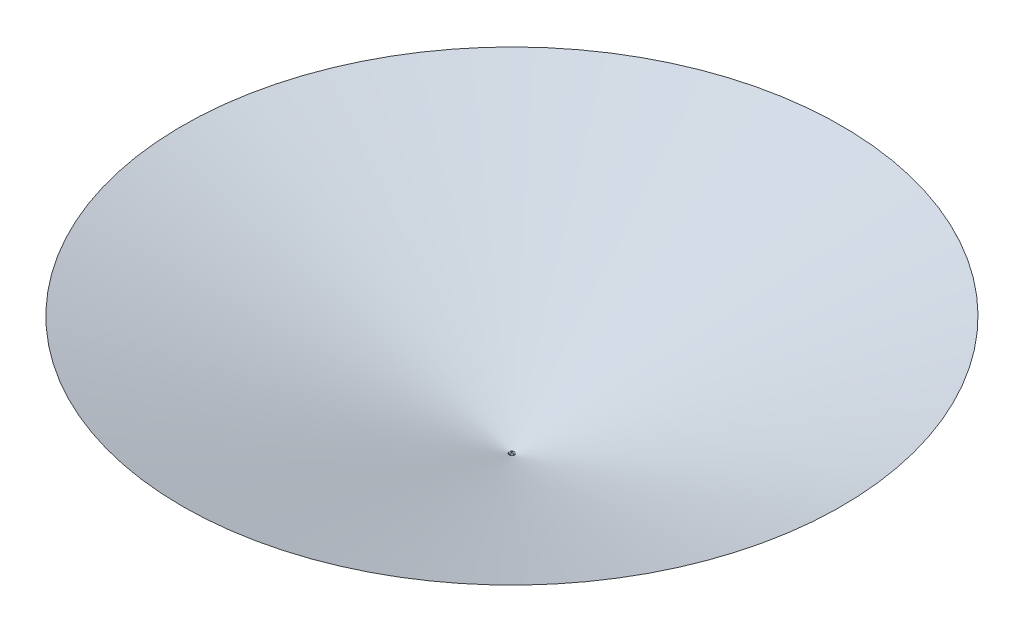
from build123d import *

# Parameters (mm, degrees)
SKETCH1_W           = 38
SKETCH1_H           = 38
BOSS_EXTRUDE1_DEPTH = 1.6
BOSS_EXTRUDE2_DEPTH = 3.5
SKETCH3_R           = 1.25
BOSS_EXTRUDE3_DEPTH = 5
CIRPATTERN1_COUNT   = 22
SKETCH5_W           = 7.5
SKETCH5_H           = 3.75
BOSS_EXTRUDE4_DEPTH = 4.75
SKETCH6_R           = 1.4
SKETCH6_R_2         = 0.35
CUT_EXTRUDE1_DEPTH  = 32.401632123


# Read off the part's stored shape, not the designer's step: FOV
with BuildPart() as part:
    # Sketch1 → Boss-Extrude1 (new body)
    with BuildSketch(Plane(origin=(0, 0, 0), x_dir=(1, 0, 0), z_dir=(0, 1, 0))):
        Rectangle(SKETCH1_W, SKETCH1_H)
    extrude(amount=BOSS_EXTRUDE1_DEPTH)

    # Sketch2 → Boss-Extrude2 (add)
    with BuildSketch(Plane(origin=(0, 1.6, 0), x_dir=(1, 0, 0), z_dir=(0, 1, 0))):
        with BuildLine():
            Line((-6.55, 2), (-9, 2))
            ThreePointArc((-9, 2), (-11, 0), (-9, -2))
            Line((-9, -2), (-6.55, -2))
            Line((-6.55, -2), (-6.55, -6.55))
            Line((-6.55, -6.55), (6.55, -6.55))
            Line((6.55, -6.55), (6.55, -2))
            Line((6.55, -2), (9, -2))
            ThreePointArc((9, -2), (11, 0), (9, 2))
            Line((9, 2), (6.55, 2))
            Line((6.55, 2), (6.55, 6.55))
            Line((6.55, 6.55), (-6.55, 6.55))
            Line((-6.55, 6.55), (-6.55, 2))
        make_face()
    extrude(amount=BOSS_EXTRUDE2_DEPTH)

    # Sketch4 → Revolve1 (revolve)
    with BuildSketch(Plane.XY, mode=Mode.PRIVATE) as revolve1_sk:
        with BuildLine():
            Line((0, 0), (0, 17.65))
            ThreePointArc((0, 17.65), (-2.096194346, 17.328770041), (-4, 16.394562647))
            Line((-4, 16.394562647), (-4, 16.494562647))
            Line((-4, 16.494562647), (-6.5, 17.85))
            Line((-6.5, 17.85), (-7, 17.85))
            Line((-7, 17.85), (-7, 13.55))
            Line((-7, 13.55), (-5.5, 13.55))
            Line((-5.5, 13.55), (-5.5, 0))
            Line((-5.5, 0), (0, 0))
        make_face()
    revolve(revolve1_sk.sketch.rotate(Axis((0, 0, 0), (0, -1, 0)), 270), axis=Axis((0, 0, 0), (0, -1, 0)))

    # Sketch3 → Boss-Extrude3 (add)
    with BuildSketch(Plane(origin=(0, 5.1, 0), x_dir=(1, 0, 0), z_dir=(0, 1, 0))):
        with Locations((5.7, 0)):
            Circle(SKETCH3_R)
    boss_extrude3 = extrude(amount=BOSS_EXTRUDE3_DEPTH)

    # CirPattern1: Boss-Extrude3 ×22 about axis
    cirpattern1_axis = Axis((0, 0, 0), (0, 1, 0))
    for i in range(1, CIRPATTERN1_COUNT):
        add(boss_extrude3.rotate(cirpattern1_axis, i * 360 / CIRPATTERN1_COUNT))

    # Sketch5 → Boss-Extrude4 (add)
    with BuildSketch(Plane.XZ):
        with Locations((-6.75, 13.525)):
            Rectangle(SKETCH5_W, SKETCH5_H)
    extrude(amount=BOSS_EXTRUDE4_DEPTH)

    # Sketch6 → Cut-Extrude1 (cut, through all)
    with BuildSketch(Plane(origin=(0, 1.6, 0), x_dir=(1, 0, 0), z_dir=(0, 1, 0))):
        with Locations(Location((-14, 14, 0), (0, 0, 270))):
            Circle(SKETCH6_R)
        with Locations(Location((-7.25, 16.65, 0), (0, 0, 270))):
            Circle(SKETCH6_R_2)
        with Locations(Location((7.25, 16.65, 0), (0, 0, 270))):
            Circle(SKETCH6_R_2)
        with Locations(Location((14, 14, 0), (0, 0, 270))):
            Circle(SKETCH6_R)
        with Locations(Location((16.65, 7.25, 0), (0, 0, 270))):
            Circle(SKETCH6_R_2)
        with Locations(Location((16.65, -7.25, 0), (0, 0, 270))):
            Circle(SKETCH6_R_2)
        with Locations(Location((14, -14, 0), (0, 0, 270))):
            Circle(SKETCH6_R)
        with Locations(Location((7.25, -16.65, 0), (0, 0, 270))):
            Circle(SKETCH6_R_2)
        with Locations(Location((-7.25, -16.65, 0), (0, 0, 270))):
            Circle(SKETCH6_R_2)
        with Locations(Location((-14, -14, 0), (0, 0, 270))):
            Circle(SKETCH6_R)
        with Locations(Location((-16.65, -7.25, 0), (0, 0, 270))):
            Circle(SKETCH6_R_2)
        with Locations(Location((-16.65, 7.25, 0), (0, 0, 270))):
            Circle(SKETCH6_R_2)
        with BuildLine():
            Line((-15.715476742, 17.2), (-8.6, 17.2))
            ThreePointArc((-8.6, 17.2), (-8.05, 16.65), (-8.6, 16.1))
            Line((-8.6, 16.1), (-14, 16.1))
            ThreePointArc((-14, 16.1), (-15.48492424, 15.48492424), (-16.1, 14))
            Line((-16.1, 14), (-16.1, 8.6))
            ThreePointArc((-16.1, 8.6), (-16.65, 8.05), (-17.2, 8.6))
            Line((-17.2, 8.6), (-17.2, 15.715476742))
            ThreePointArc((-17.2, 15.715476742), (-17.919238816, 17.919238816), (-15.715476742, 17.2))
        make_face()
        with BuildLine():
            Line((-5.9, 17.2), (5.9, 17.2))
            ThreePointArc((5.9, 17.2), (6.45, 16.65), (5.9, 16.1))
            Line((5.9, 16.1), (-5.9, 16.1))
            ThreePointArc((-5.9, 16.1), (-6.45, 16.65), (-5.9, 17.2))
        make_face()
        with BuildLine():
            Line((14, 16.1), (8.6, 16.1))
            ThreePointArc((8.6, 16.1), (8.05, 16.65), (8.6, 17.2))
            Line((8.6, 17.2), (15.715476742, 17.2))
            ThreePointArc((15.715476742, 17.2), (17.919238816, 17.919238816), (17.2, 15.715476742))
            Line((17.2, 15.715476742), (17.2, 8.6))
            ThreePointArc((17.2, 8.6), (16.65, 8.05), (16.1, 8.6))
            Line((16.1, 8.6), (16.1, 14))
            ThreePointArc((16.1, 14), (15.48492424, 15.48492424), (14, 16.1))
        make_face()
        with BuildLine():
            Line((16.1, -5.9), (16.1, 5.9))
            ThreePointArc((16.1, 5.9), (16.65, 6.45), (17.2, 5.9))
            Line((17.2, 5.9), (17.2, -5.9))
            ThreePointArc((17.2, -5.9), (16.65, -6.45), (16.1, -5.9))
        make_face()
        with BuildLine():
            Line((16.1, -14), (16.1, -8.6))
            ThreePointArc((16.1, -8.6), (16.65, -8.05), (17.2, -8.6))
            Line((17.2, -8.6), (17.2, -15.715476742))
            ThreePointArc((17.2, -15.715476742), (17.919238816, -17.919238816), (15.715476742, -17.2))
            Line((15.715476742, -17.2), (8.6, -17.2))
            ThreePointArc((8.6, -17.2), (8.05, -16.65), (8.6, -16.1))
            Line((8.6, -16.1), (14, -16.1))
            ThreePointArc((14, -16.1), (15.48492424, -15.48492424), (16.1, -14))
        make_face()
        with BuildLine():
            Line((-5.9, -16.1), (5.9, -16.1))
            ThreePointArc((5.9, -16.1), (6.45, -16.65), (5.9, -17.2))
            Line((5.9, -17.2), (-5.9, -17.2))
            ThreePointArc((-5.9, -17.2), (-6.45, -16.65), (-5.9, -16.1))
        make_face()
        with BuildLine():
            Line((-14, -16.1), (-8.6, -16.1))
            ThreePointArc((-8.6, -16.1), (-8.05, -16.65), (-8.6, -17.2))
            Line((-8.6, -17.2), (-15.715476742, -17.2))
            ThreePointArc((-15.715476742, -17.2), (-17.919238816, -17.919238816), (-17.2, -15.715476742))
            Line((-17.2, -15.715476742), (-17.2, -8.6))
            ThreePointArc((-17.2, -8.6), (-16.65, -8.05), (-16.1, -8.6))
            Line((-16.1, -8.6), (-16.1, -14))
            ThreePointArc((-16.1, -14), (-15.48492424, -15.48492424), (-14, -16.1))
        make_face()
        with BuildLine():
            Line((-16.1, 5.9), (-16.1, -5.9))
            ThreePointArc((-16.1, -5.9), (-16.65, -6.45), (-17.2, -5.9))
            Line((-17.2, -5.9), (-17.2, 5.9))
            ThreePointArc((-17.2, 5.9), (-16.65, 6.45), (-16.1, 5.9))
        make_face()
    extrude(amount=-CUT_EXTRUDE1_DEPTH, mode=Mode.SUBTRACT)


with BuildPart() as body_2:
    # FOV outline → FOV (revolve)
    with BuildSketch(Plane.XY):
        Polygon((863.25403634, 329.237781704), (3.999103893, 16.494562647), (4, 16.494562647), (863.254932447, 329.237781704), align=None)
    revolve(axis=Axis((0, 0, 0), (0, 1, 0)))


solid = Compound([part.part, body_2.part])
